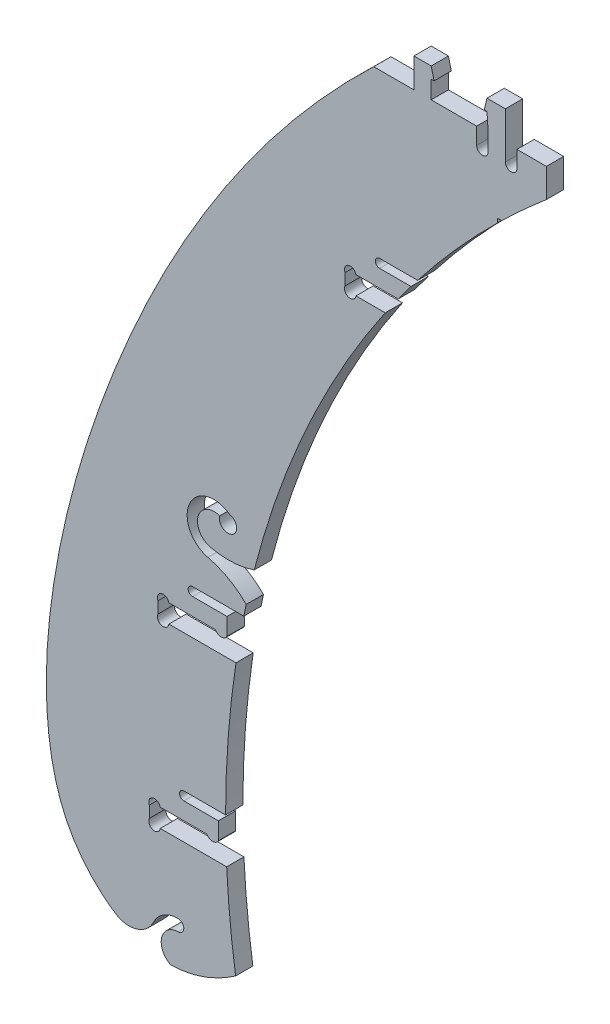
from build123d import *

# Parameters (mm, degrees)
BOSS_EXTRUDE1_DEPTH          = 1.5
BOSS_EXTRUDE1_DEPTH_BACK     = 1.5
PLATE1_SLOT_DEPTH            = 268.75601623
PLATE2_SLOT_DEPTH            = 268.75601623
PLATE3_SLOT_START            = -3
PLATE3_SLOT_DEPTH            = 3
UPPER_START                  = -1.5
UPPER_BAND_HOOK_DEPTH        = 3
LOWER_BAND_HOOK_DEPTH        = 268.75601623
TOP_PLATE_TEETH_DEPTH        = 3
TOP_PLATE_TEETH_RELIEF_REACH = 274.419
SERVO_CLEARANCE_DEPTH        = 273.418652776


# Read off the part's stored shape, not the designer's step: upper band hook
with BuildPart() as part:
    # Sketch1 → Boss-Extrude1 (new, two sides: drawn at the far end of the back side and taken through both)
    with BuildSketch(Plane.XY.offset(-BOSS_EXTRUDE1_DEPTH_BACK)):
        with BuildLine():
            Line((-22.5, 244.375309013), (-52.5, 244.375309013))
            add(Edge.make_bspline(
                [(-52.5, 244.375309013), (-66.367869978, 231.126229196), (-86.384732952, 206.641303547), (-108.858903818, 146.113641656), (-112.113384109, 114.033108561), (-99.555792699, 93.554916207), (-87.306535283, 88.078010017), (-76.5, 95.556683179)],
                knots=[0, 0, 0, 0, 0.402834442, 0.481428609, 0.752106882, 0.807347499, 1, 1, 1, 1], degree=3))
            ThreePointArc((-76.5, 95.556683179), (-68.155677229, 174.470697778), (-22.5, 239.375309013))
            Line((-22.5, 239.375309013), (-22.5, 244.375309013))
        make_face()
    extrude(amount=BOSS_EXTRUDE1_DEPTH + BOSS_EXTRUDE1_DEPTH_BACK)

    # Sketch2 → plate1-slot (cut, through all)
    with BuildSketch(Plane(origin=(0, 0, -1.5), x_dir=(-1, 0, 0), z_dir=(0, 0, -1))):
        with BuildLine():
            Line((79.487704092, 114.414134112), (79.487704092, 117.414134112))
            Line((79.487704092, 117.414134112), (85.487704092, 117.414134112))
            ThreePointArc((85.487704092, 117.414134112), (86.237704092, 118.164134112), (85.487704092, 118.914134112))
            Line((85.487704092, 118.914134112), (64.487704092, 118.914134112))
            Line((64.487704092, 118.914134112), (64.487704092, 111.214134112))
            Line((64.487704092, 111.214134112), (79.487704092, 111.214134112))
            Line((79.487704092, 111.214134112), (89.59595837, 111.214134112))
            ThreePointArc((89.59595837, 111.214134112), (90.873465132, 110.384053417), (91.487704092, 111.778244218))
            Line((91.487704092, 111.778244218), (91.487704092, 113.778244218))
            ThreePointArc((91.487704092, 113.778244218), (90.908142597, 115.161403432), (89.607908195, 114.414134112))
            Line((89.607908195, 114.414134112), (81.487704092, 114.414134112))
            ThreePointArc((81.487704092, 114.414134112), (80.487704092, 113.814134112), (79.487704092, 114.414134112))
        make_face()
    extrude(amount=-PLATE1_SLOT_DEPTH, mode=Mode.SUBTRACT)

    # Sketch3 → plate2-slot (cut, through all)
    with BuildSketch(Plane(origin=(0, 0, -1.5), x_dir=(-1, 0, 0), z_dir=(0, 0, -1))):
        with BuildLine():
            Line((77.987499132, 145.912279649), (77.987499132, 148.912279649))
            Line((77.987499132, 148.912279649), (83.987499132, 148.912279649))
            ThreePointArc((83.987499132, 148.912279649), (84.737499132, 149.662279649), (83.987499132, 150.412279649))
            Line((83.987499132, 150.412279649), (62.987499132, 150.412279649))
            Line((62.987499132, 150.412279649), (62.987499132, 142.712279649))
            Line((62.987499132, 142.712279649), (77.987499132, 142.712279649))
            Line((77.987499132, 142.712279649), (88.09575341, 142.712279649))
            ThreePointArc((88.09575341, 142.712279649), (89.373260172, 141.882198954), (89.987499132, 143.276389755))
            Line((89.987499132, 143.276389755), (89.987499132, 145.276389755))
            ThreePointArc((89.987499132, 145.276389755), (89.407937637, 146.659548969), (88.107703235, 145.912279649))
            Line((88.107703235, 145.912279649), (79.987499132, 145.912279649))
            ThreePointArc((79.987499132, 145.912279649), (78.987499132, 145.312279649), (77.987499132, 145.912279649))
        make_face()
    extrude(amount=-PLATE2_SLOT_DEPTH, mode=Mode.SUBTRACT)

    # Sketch4 → plate3-slot (cut)
    with BuildSketch(Plane(origin=(0, 0, -1.5), x_dir=(-1, 0, 0), z_dir=(0, 0, -1)).offset(PLATE3_SLOT_START)):
        with BuildLine():
            Line((45.480431453, 211.541310922), (45.480431453, 214.541310922))
            Line((45.480431453, 214.541310922), (51.480431453, 214.541310922))
            ThreePointArc((51.480431453, 214.541310922), (52.230431453, 215.291310922), (51.480431453, 216.041310922))
            Line((51.480431453, 216.041310922), (30.480431453, 216.041310922))
            Line((30.480431453, 216.041310922), (30.480431453, 208.341310922))
            Line((30.480431453, 208.341310922), (45.480431453, 208.341310922))
            Line((45.480431453, 208.341310922), (55.588685731, 208.341310922))
            ThreePointArc((55.588685731, 208.341310922), (56.866192493, 207.511230226), (57.480431453, 208.905421027))
            Line((57.480431453, 208.905421027), (57.480431453, 210.905421027))
            ThreePointArc((57.480431453, 210.905421027), (56.900869958, 212.288580241), (55.600635556, 211.541310922))
            Line((55.600635556, 211.541310922), (47.480431453, 211.541310922))
            ThreePointArc((47.480431453, 211.541310922), (46.480431453, 210.941310922), (45.480431453, 211.541310922))
        make_face()
    extrude(amount=PLATE3_SLOT_DEPTH, mode=Mode.SUBTRACT)

    # upper band hook outline → upper band hook (cut)
    with BuildSketch(Plane.XY.offset(UPPER_START)):
        with BuildLine():
            ThreePointArc((-77.509182055, 164.490649705), (-84.498712373, 162.637889725), (-81.321034284, 156.14261332))
            ThreePointArc((-81.321034284, 156.14261332), (-77.723407217, 154.73588636), (-74.655916798, 152.38805677))
            ThreePointArc((-74.655916798, 152.38805677), (-73.988672918, 155.331583344), (-73.265324436, 158.261827372))
            ThreePointArc((-73.265324436, 158.261827372), (-77.059884741, 157.538561622), (-80.906354002, 157.894195537))
            ThreePointArc((-80.906354002, 157.894195537), (-83.002325348, 161.513908871), (-79.270729863, 163.403516141))
            ThreePointArc((-79.270729863, 163.403516141), (-77.031979162, 161.746671557), (-77.509182055, 164.490649705))
        make_face()
    extrude(amount=UPPER_BAND_HOOK_DEPTH, mode=Mode.SUBTRACT)

    # Sketch7 → lower band hook (cut, through all)
    with BuildSketch(Plane(origin=(0, 0, -1.5), x_dir=(-1, 0, 0), z_dir=(0, 0, -1))):
        with BuildLine():
            Line((-218.104253523, -68.140600113), (87.833291208, 91.612508945))
            ThreePointArc((87.833291208, 91.612508945), (89.346413744, 94.937455747), (86.489614642, 97.214188042))
            ThreePointArc((86.489614642, 97.214188042), (85.500013482, 98.219326861), (86.5, 99.214134112))
            ThreePointArc((86.5, 99.214134112), (89.019498135, 98.485649701), (90.761466541, 96.525010402))
            ThreePointArc((90.761466541, 96.525010402), (93.332622526, 94.148850656), (96.833291208, 94.196777889))
            Line((96.833291208, 94.196777889), (415.586561712, 226.541742558))
            Line((415.586561712, 226.541742558), (706.648712408, -399.364139305))
            Line((706.648712408, -399.364139305), (72.957897174, -694.046481976))
            Line((72.957897174, -694.046481976), (-218.104253523, -68.140600113))
        make_face()
    extrude(amount=-LOWER_BAND_HOOK_DEPTH, mode=Mode.SUBTRACT)

    # Sketch15 → top-plate-teeth (add)
    with BuildSketch(Plane.XY.offset(1.5)):
        with BuildLine():
            Line((-42.51998799, 247.475309013), (-42.51998799, 244.375309013))
            Line((-42.51998799, 244.375309013), (-34.61998799, 244.375309013))
            Line((-34.61998799, 244.375309013), (-34.61998799, 241.475309013))
            ThreePointArc((-34.61998799, 241.475309013), (-33.61998799, 240.475309013), (-32.61998799, 241.475309013))
            Line((-32.61998799, 241.475309013), (-32.61998799, 244.375309013))
            Line((-32.61998799, 244.375309013), (-32.81998799, 247.475309013))
            Line((-32.81998799, 247.475309013), (-33.31998799, 247.475309013))
            Line((-33.31998799, 247.475309013), (-32.81998799, 249.475309013))
            Line((-32.81998799, 249.475309013), (-29.61998799, 249.475309013))
            Line((-29.61998799, 249.475309013), (-29.61998799, 241.475309013))
            Line((-29.61998799, 241.475309013), (-29.61998799, 237.475309013))
            Line((-29.61998799, 237.475309013), (-45.51998799, 237.475309013))
            Line((-45.51998799, 237.475309013), (-45.51998799, 249.475309013))
            Line((-45.51998799, 249.475309013), (-42.51998799, 249.475309013))
            Line((-42.51998799, 249.475309013), (-42.01998799, 247.475309013))
            Line((-42.01998799, 247.475309013), (-42.51998799, 247.475309013))
        make_face()
    extrude(amount=-TOP_PLATE_TEETH_DEPTH)

    # Sketch17 → top-plate-teeth-relief (cut, up to next)
    with BuildSketch(Plane.XY.offset(1.5), mode=Mode.PRIVATE) as top_plate_teeth_relief_sk1:
        with BuildLine():
            Line((-34.61998799, 244.375309013), (-32.61998799, 244.375309013))
            Line((-32.61998799, 244.375309013), (-32.61998799, 241.475309013))
            ThreePointArc((-32.61998799, 241.475309013), (-33.61998799, 240.475309013), (-34.61998799, 241.475309013))
            Line((-34.61998799, 241.475309013), (-34.61998799, 244.375309013))
        make_face()
    top_plate_teeth_relief_tool1 = extrude(top_plate_teeth_relief_sk1.sketch, amount=-TOP_PLATE_TEETH_RELIEF_REACH, mode=Mode.PRIVATE) & part.part
    # Sketch17 → top-plate-teeth-relief (cut, up to next)
    with BuildSketch(Plane.XY.offset(1.5), mode=Mode.PRIVATE) as top_plate_teeth_relief_sk2:
        with BuildLine():
            Line((-29.61998799, 244.375309013), (-29.61998799, 241.475309013))
            ThreePointArc((-29.61998799, 241.475309013), (-28.61998799, 240.475309013), (-27.61998799, 241.475309013))
            Line((-27.61998799, 241.475309013), (-27.61998799, 244.375309013))
            Line((-27.61998799, 244.375309013), (-29.61998799, 244.375309013))
        make_face()
    top_plate_teeth_relief_tool2 = extrude(top_plate_teeth_relief_sk2.sketch, amount=-TOP_PLATE_TEETH_RELIEF_REACH, mode=Mode.PRIVATE) & part.part
    add(top_plate_teeth_relief_tool1.solids().sort_by_distance((-33.619988, 242.525851, 1.5))[0], mode=Mode.SUBTRACT)
    add(top_plate_teeth_relief_tool2.solids().sort_by_distance((-28.619988, 242.525851, 1.5))[0], mode=Mode.SUBTRACT)

    # Sketch10 → servo clearance (cut, through all)
    with BuildSketch(Plane.XY.offset(1.5)):
        Polygon((-31, -101.29759897), (-31, 231.608085493), (-31, 232.341310922), (-30.249126131, 232.341310922), (302.656558332, 232.341310922), (773.443840549, -238.47087445), (439.787282217, -572.109784342), align=None)
    extrude(amount=-SERVO_CLEARANCE_DEPTH, mode=Mode.SUBTRACT)


solid = part.part
